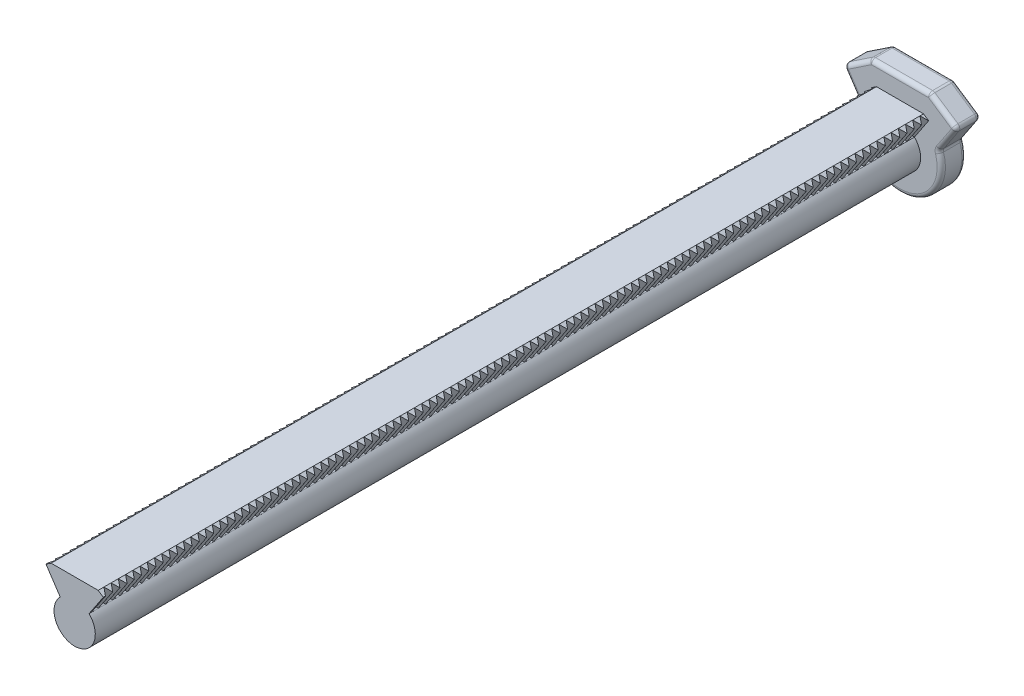
from build123d import *
from OCP.BRepFilletAPI import BRepFilletAPI_MakeChamfer

# Parameters (mm, degrees)
SALIENTE_EXTRUIR1_DEPTH  = 200
CHAFL_N2_SIZE            = 1
CHAFL_N2_SIZE2           = 1.800819464
CORTAR_EXTRUIR1_DEPTH    = 6.2
MATRIZL1_COUNT           = 114
MATRIZL1_PITCH           = 1.75
SIMETR_A1_COPY_1_DEPTH   = 6.2
SIMETR_A1_COPY_2_DEPTH   = 6.2
SIMETR_A1_COPY_3_DEPTH   = 6.2
SIMETR_A1_COPY_4_DEPTH   = 6.2
SIMETR_A1_COPY_5_DEPTH   = 6.2
SIMETR_A1_COPY_6_DEPTH   = 6.2
SIMETR_A1_COPY_7_DEPTH   = 6.2
SIMETR_A1_COPY_8_DEPTH   = 6.2
SIMETR_A1_COPY_9_DEPTH   = 6.2
SIMETR_A1_COPY_10_DEPTH  = 6.2
SIMETR_A1_COPY_11_DEPTH  = 6.2
SIMETR_A1_COPY_12_DEPTH  = 6.2
SIMETR_A1_COPY_13_DEPTH  = 6.2
SIMETR_A1_COPY_14_DEPTH  = 6.2
SIMETR_A1_COPY_15_DEPTH  = 6.2
SIMETR_A1_COPY_16_DEPTH  = 6.2
SIMETR_A1_COPY_17_DEPTH  = 6.2
SIMETR_A1_COPY_18_DEPTH  = 6.2
SIMETR_A1_COPY_19_DEPTH  = 6.2
SIMETR_A1_COPY_20_DEPTH  = 6.2
SIMETR_A1_COPY_21_DEPTH  = 6.2
SIMETR_A1_COPY_22_DEPTH  = 6.2
SIMETR_A1_COPY_23_DEPTH  = 6.2
SIMETR_A1_COPY_24_DEPTH  = 6.2
SIMETR_A1_COPY_25_DEPTH  = 6.2
SIMETR_A1_COPY_26_DEPTH  = 6.2
SIMETR_A1_COPY_27_DEPTH  = 6.2
SIMETR_A1_COPY_28_DEPTH  = 6.2
SIMETR_A1_COPY_29_DEPTH  = 6.2
SIMETR_A1_COPY_30_DEPTH  = 6.2
SIMETR_A1_COPY_31_DEPTH  = 6.2
SIMETR_A1_COPY_32_DEPTH  = 6.2
SIMETR_A1_COPY_33_DEPTH  = 6.2
SIMETR_A1_COPY_34_DEPTH  = 6.2
SIMETR_A1_COPY_35_DEPTH  = 6.2
SIMETR_A1_COPY_36_DEPTH  = 6.2
SIMETR_A1_COPY_37_DEPTH  = 6.2
SIMETR_A1_COPY_38_DEPTH  = 6.2
SIMETR_A1_COPY_39_DEPTH  = 6.2
SIMETR_A1_COPY_40_DEPTH  = 6.2
SIMETR_A1_COPY_41_DEPTH  = 6.2
SIMETR_A1_COPY_42_DEPTH  = 6.2
SIMETR_A1_COPY_43_DEPTH  = 6.2
SIMETR_A1_COPY_44_DEPTH  = 6.2
SIMETR_A1_COPY_45_DEPTH  = 6.2
SIMETR_A1_COPY_46_DEPTH  = 6.2
SIMETR_A1_COPY_47_DEPTH  = 6.2
SIMETR_A1_COPY_48_DEPTH  = 6.2
SIMETR_A1_COPY_49_DEPTH  = 6.2
SIMETR_A1_COPY_50_DEPTH  = 6.2
SIMETR_A1_COPY_51_DEPTH  = 6.2
SIMETR_A1_COPY_52_DEPTH  = 6.2
SIMETR_A1_COPY_53_DEPTH  = 6.2
SIMETR_A1_COPY_54_DEPTH  = 6.2
SIMETR_A1_COPY_55_DEPTH  = 6.2
SIMETR_A1_COPY_56_DEPTH  = 6.2
SIMETR_A1_COPY_57_DEPTH  = 6.2
SIMETR_A1_COPY_58_DEPTH  = 6.2
SIMETR_A1_COPY_59_DEPTH  = 6.2
SIMETR_A1_COPY_60_DEPTH  = 6.2
SIMETR_A1_COPY_61_DEPTH  = 6.2
SIMETR_A1_COPY_62_DEPTH  = 6.2
SIMETR_A1_COPY_63_DEPTH  = 6.2
SIMETR_A1_COPY_64_DEPTH  = 6.2
SIMETR_A1_COPY_65_DEPTH  = 6.2
SIMETR_A1_COPY_66_DEPTH  = 6.2
SIMETR_A1_COPY_67_DEPTH  = 6.2
SIMETR_A1_COPY_68_DEPTH  = 6.2
SIMETR_A1_COPY_69_DEPTH  = 6.2
SIMETR_A1_COPY_70_DEPTH  = 6.2
SIMETR_A1_COPY_71_DEPTH  = 6.2
SIMETR_A1_COPY_72_DEPTH  = 6.2
SIMETR_A1_COPY_73_DEPTH  = 6.2
SIMETR_A1_COPY_74_DEPTH  = 6.2
SIMETR_A1_COPY_75_DEPTH  = 6.2
SIMETR_A1_COPY_76_DEPTH  = 6.2
SIMETR_A1_COPY_77_DEPTH  = 6.2
SIMETR_A1_COPY_78_DEPTH  = 6.2
SIMETR_A1_COPY_79_DEPTH  = 6.2
SIMETR_A1_COPY_80_DEPTH  = 6.2
SIMETR_A1_COPY_81_DEPTH  = 6.2
SIMETR_A1_COPY_82_DEPTH  = 6.2
SIMETR_A1_COPY_83_DEPTH  = 6.2
SIMETR_A1_COPY_84_DEPTH  = 6.2
SIMETR_A1_COPY_85_DEPTH  = 6.2
SIMETR_A1_COPY_86_DEPTH  = 6.2
SIMETR_A1_COPY_87_DEPTH  = 6.2
SIMETR_A1_COPY_88_DEPTH  = 6.2
SIMETR_A1_COPY_89_DEPTH  = 6.2
SIMETR_A1_COPY_90_DEPTH  = 6.2
SIMETR_A1_COPY_91_DEPTH  = 6.2
SIMETR_A1_COPY_92_DEPTH  = 6.2
SIMETR_A1_COPY_93_DEPTH  = 6.2
SIMETR_A1_COPY_94_DEPTH  = 6.2
SIMETR_A1_COPY_95_DEPTH  = 6.2
SIMETR_A1_COPY_96_DEPTH  = 6.2
SIMETR_A1_COPY_97_DEPTH  = 6.2
SIMETR_A1_COPY_98_DEPTH  = 6.2
SIMETR_A1_COPY_99_DEPTH  = 6.2
SIMETR_A1_COPY_100_DEPTH = 6.2
SIMETR_A1_COPY_101_DEPTH = 6.2
SIMETR_A1_COPY_102_DEPTH = 6.2
SIMETR_A1_COPY_103_DEPTH = 6.2
SIMETR_A1_COPY_104_DEPTH = 6.2
SIMETR_A1_COPY_105_DEPTH = 6.2
SIMETR_A1_COPY_106_DEPTH = 6.2
SIMETR_A1_COPY_107_DEPTH = 6.2
SIMETR_A1_COPY_108_DEPTH = 6.2
SIMETR_A1_COPY_109_DEPTH = 6.2
SIMETR_A1_COPY_110_DEPTH = 6.2
SIMETR_A1_COPY_111_DEPTH = 6.2
SIMETR_A1_COPY_112_DEPTH = 6.2
SIMETR_A1_COPY_113_DEPTH = 6.2
SALIENTE_EXTRUIR2_DEPTH  = 6
REDONDEO1_R              = 1


with BuildPart() as part:
    # Croquis1 → Saliente-Extruir1 (new body)
    with BuildSketch(Plane.XY):
        with BuildLine():
            ThreePointArc((3.493719232, 3.576859786), (0, 5), (-3.493719232, 3.576859786))
            Line((-3.493719232, 3.576859786), (3.493719232, 3.576859786))
        make_face()
        with BuildLine():
            Line((3.493719232, 3.576859786), (-3.493719232, 3.576859786))
            ThreePointArc((-3.493719232, 3.576859786), (-1.940541656, -4.608068802), (5, 0))
            ThreePointArc((5, 0), (4.608068802, 1.940541656), (3.493719232, 3.576859786))
        make_face()
        with BuildLine():
            Line((-7.5, 9.576859786), (-3.493719232, 3.576859786))
            ThreePointArc((-3.493719232, 3.576859786), (0, 5), (3.493719232, 3.576859786))
            Line((3.493719232, 3.576859786), (7.5, 9.576859786))
            Line((7.5, 9.576859786), (-7.5, 9.576859786))
        make_face()
    extrude(amount=SALIENTE_EXTRUIR1_DEPTH)

    # Chaflán2: one chamfer whose edges measure the first distance from different faces: ONE call of the kernel's chamfer builder (chamfer() names one face for all edges)
    chafl_n2_edges_1 = [part.edges().sort_by_distance(p)[0] for p in [
        (-7.5, 9.576859786, 100),
    ]]
    chafl_n2_side_1 = [part.faces().sort_by_distance(p)[0] for p in [
        (-5.496859616, 6.576859786, 100),
    ]]
    chafl_n2_edges_2 = [part.edges().sort_by_distance(p)[0] for p in [
        (7.5, 9.576859786, 100),
    ]]
    chafl_n2_side_2 = [part.faces().sort_by_distance(p)[0] for p in [
        (5.496859616, 6.576859786, 100),
    ]]
    chafl_n2 = BRepFilletAPI_MakeChamfer(part.part.solid().wrapped)
    for e in chafl_n2_edges_1:
        chafl_n2.Add(CHAFL_N2_SIZE, CHAFL_N2_SIZE2, e.wrapped, chafl_n2_side_1[0].wrapped)  # the first distance lies on this face
    for e in chafl_n2_edges_2:
        chafl_n2.Add(CHAFL_N2_SIZE, CHAFL_N2_SIZE2, e.wrapped, chafl_n2_side_2[0].wrapped)  # the first distance lies on this face
    add(Compound.cast(chafl_n2.Shape()), mode=Mode.REPLACE)

    # Croquis2 → Cortar-Extruir1 (cut)
    with BuildSketch(Plane(origin=(6.180158411, 9.255704384, 0), x_dir=(0.8316482768383068, -0.555302749526666, 0), z_dir=(0.555302749526666, 0.8316482768383068, 0))):
        Polygon((0.919305505, 0), (0.919305505, -1.729335419), (-0.578342899, -0.864667709), align=None)
    cortar_extruir1 = extrude(amount=-CORTAR_EXTRUIR1_DEPTH, mode=Mode.SUBTRACT)

    # MatrizL1: Cortar-Extruir1 ×114
    with Locations(*[(0, 0, i * MATRIZL1_PITCH) for i in range(1, MATRIZL1_COUNT)]):
        add(cortar_extruir1, mode=Mode.SUBTRACT)

    # Simetría1: Cortar-Extruir1 across plane
    add(cortar_extruir1.mirror(Plane(origin=(0, 0, 0), x_dir=(0, 0, 1), z_dir=(1, 0, 0))), mode=Mode.SUBTRACT)

    # Simetría1 copy 1 sketch → Simetría1 copy 1 (cut)
    with BuildSketch(Plane(origin=(-6.180158411, 9.255704384, 1.75), x_dir=(-0.8316482768383068, -0.555302749526666, 0), z_dir=(-0.555302749526666, 0.8316482768383068, 0))):
        Polygon((0.919305505, 0), (0.919305505, 1.729335419), (-0.578342899, 0.864667709), align=None)
    extrude(amount=-SIMETR_A1_COPY_1_DEPTH, mode=Mode.SUBTRACT)

    # Simetría1 copy 2 sketch → Simetría1 copy 2 (cut)
    with BuildSketch(Plane(origin=(-6.180158411, 9.255704384, 3.5), x_dir=(-0.8316482768383068, -0.555302749526666, 0), z_dir=(-0.555302749526666, 0.8316482768383068, 0))):
        Polygon((0.919305505, 0), (0.919305505, 1.729335419), (-0.578342899, 0.864667709), align=None)
    extrude(amount=-SIMETR_A1_COPY_2_DEPTH, mode=Mode.SUBTRACT)

    # Simetría1 copy 3 sketch → Simetría1 copy 3 (cut)
    with BuildSketch(Plane(origin=(-6.180158411, 9.255704384, 5.25), x_dir=(-0.8316482768383068, -0.555302749526666, 0), z_dir=(-0.555302749526666, 0.8316482768383068, 0))):
        Polygon((0.919305505, 0), (0.919305505, 1.729335419), (-0.578342899, 0.864667709), align=None)
    extrude(amount=-SIMETR_A1_COPY_3_DEPTH, mode=Mode.SUBTRACT)

    # Simetría1 copy 4 sketch → Simetría1 copy 4 (cut)
    with BuildSketch(Plane(origin=(-6.180158411, 9.255704384, 7), x_dir=(-0.8316482768383068, -0.555302749526666, 0), z_dir=(-0.555302749526666, 0.8316482768383068, 0))):
        Polygon((0.919305505, 0), (0.919305505, 1.729335419), (-0.578342899, 0.864667709), align=None)
    extrude(amount=-SIMETR_A1_COPY_4_DEPTH, mode=Mode.SUBTRACT)

    # Simetría1 copy 5 sketch → Simetría1 copy 5 (cut)
    with BuildSketch(Plane(origin=(-6.180158411, 9.255704384, 8.75), x_dir=(-0.8316482768383068, -0.555302749526666, 0), z_dir=(-0.555302749526666, 0.8316482768383068, 0))):
        Polygon((0.919305505, 0), (0.919305505, 1.729335419), (-0.578342899, 0.864667709), align=None)
    extrude(amount=-SIMETR_A1_COPY_5_DEPTH, mode=Mode.SUBTRACT)

    # Simetría1 copy 6 sketch → Simetría1 copy 6 (cut)
    with BuildSketch(Plane(origin=(-6.180158411, 9.255704384, 10.5), x_dir=(-0.8316482768383068, -0.555302749526666, 0), z_dir=(-0.555302749526666, 0.8316482768383068, 0))):
        Polygon((0.919305505, 0), (0.919305505, 1.729335419), (-0.578342899, 0.864667709), align=None)
    extrude(amount=-SIMETR_A1_COPY_6_DEPTH, mode=Mode.SUBTRACT)

    # Simetría1 copy 7 sketch → Simetría1 copy 7 (cut)
    with BuildSketch(Plane(origin=(-6.180158411, 9.255704384, 12.25), x_dir=(-0.8316482768383068, -0.555302749526666, 0), z_dir=(-0.555302749526666, 0.8316482768383068, 0))):
        Polygon((0.919305505, 0), (0.919305505, 1.729335419), (-0.578342899, 0.864667709), align=None)
    extrude(amount=-SIMETR_A1_COPY_7_DEPTH, mode=Mode.SUBTRACT)

    # Simetría1 copy 8 sketch → Simetría1 copy 8 (cut)
    with BuildSketch(Plane(origin=(-6.180158411, 9.255704384, 14), x_dir=(-0.8316482768383068, -0.555302749526666, 0), z_dir=(-0.555302749526666, 0.8316482768383068, 0))):
        Polygon((0.919305505, 0), (0.919305505, 1.729335419), (-0.578342899, 0.864667709), align=None)
    extrude(amount=-SIMETR_A1_COPY_8_DEPTH, mode=Mode.SUBTRACT)

    # Simetría1 copy 9 sketch → Simetría1 copy 9 (cut)
    with BuildSketch(Plane(origin=(-6.180158411, 9.255704384, 15.75), x_dir=(-0.8316482768383068, -0.555302749526666, 0), z_dir=(-0.555302749526666, 0.8316482768383068, 0))):
        Polygon((0.919305505, 0), (0.919305505, 1.729335419), (-0.578342899, 0.864667709), align=None)
    extrude(amount=-SIMETR_A1_COPY_9_DEPTH, mode=Mode.SUBTRACT)

    # Simetría1 copy 10 sketch → Simetría1 copy 10 (cut)
    with BuildSketch(Plane(origin=(-6.180158411, 9.255704384, 17.5), x_dir=(-0.8316482768383068, -0.555302749526666, 0), z_dir=(-0.555302749526666, 0.8316482768383068, 0))):
        Polygon((0.919305505, 0), (0.919305505, 1.729335419), (-0.578342899, 0.864667709), align=None)
    extrude(amount=-SIMETR_A1_COPY_10_DEPTH, mode=Mode.SUBTRACT)

    # Simetría1 copy 11 sketch → Simetría1 copy 11 (cut)
    with BuildSketch(Plane(origin=(-6.180158411, 9.255704384, 19.25), x_dir=(-0.8316482768383068, -0.555302749526666, 0), z_dir=(-0.555302749526666, 0.8316482768383068, 0))):
        Polygon((0.919305505, 0), (0.919305505, 1.729335419), (-0.578342899, 0.864667709), align=None)
    extrude(amount=-SIMETR_A1_COPY_11_DEPTH, mode=Mode.SUBTRACT)

    # Simetría1 copy 12 sketch → Simetría1 copy 12 (cut)
    with BuildSketch(Plane(origin=(-6.180158411, 9.255704384, 21), x_dir=(-0.8316482768383068, -0.555302749526666, 0), z_dir=(-0.555302749526666, 0.8316482768383068, 0))):
        Polygon((0.919305505, 0), (0.919305505, 1.729335419), (-0.578342899, 0.864667709), align=None)
    extrude(amount=-SIMETR_A1_COPY_12_DEPTH, mode=Mode.SUBTRACT)

    # Simetría1 copy 13 sketch → Simetría1 copy 13 (cut)
    with BuildSketch(Plane(origin=(-6.180158411, 9.255704384, 22.75), x_dir=(-0.8316482768383068, -0.555302749526666, 0), z_dir=(-0.555302749526666, 0.8316482768383068, 0))):
        Polygon((0.919305505, 0), (0.919305505, 1.729335419), (-0.578342899, 0.864667709), align=None)
    extrude(amount=-SIMETR_A1_COPY_13_DEPTH, mode=Mode.SUBTRACT)

    # Simetría1 copy 14 sketch → Simetría1 copy 14 (cut)
    with BuildSketch(Plane(origin=(-6.180158411, 9.255704384, 24.5), x_dir=(-0.8316482768383068, -0.555302749526666, 0), z_dir=(-0.555302749526666, 0.8316482768383068, 0))):
        Polygon((0.919305505, 0), (0.919305505, 1.729335419), (-0.578342899, 0.864667709), align=None)
    extrude(amount=-SIMETR_A1_COPY_14_DEPTH, mode=Mode.SUBTRACT)

    # Simetría1 copy 15 sketch → Simetría1 copy 15 (cut)
    with BuildSketch(Plane(origin=(-6.180158411, 9.255704384, 26.25), x_dir=(-0.8316482768383068, -0.555302749526666, 0), z_dir=(-0.555302749526666, 0.8316482768383068, 0))):
        Polygon((0.919305505, 0), (0.919305505, 1.729335419), (-0.578342899, 0.864667709), align=None)
    extrude(amount=-SIMETR_A1_COPY_15_DEPTH, mode=Mode.SUBTRACT)

    # Simetría1 copy 16 sketch → Simetría1 copy 16 (cut)
    with BuildSketch(Plane(origin=(-6.180158411, 9.255704384, 28), x_dir=(-0.8316482768383068, -0.555302749526666, 0), z_dir=(-0.555302749526666, 0.8316482768383068, 0))):
        Polygon((0.919305505, 0), (0.919305505, 1.729335419), (-0.578342899, 0.864667709), align=None)
    extrude(amount=-SIMETR_A1_COPY_16_DEPTH, mode=Mode.SUBTRACT)

    # Simetría1 copy 17 sketch → Simetría1 copy 17 (cut)
    with BuildSketch(Plane(origin=(-6.180158411, 9.255704384, 29.75), x_dir=(-0.8316482768383068, -0.555302749526666, 0), z_dir=(-0.555302749526666, 0.8316482768383068, 0))):
        Polygon((0.919305505, 0), (0.919305505, 1.729335419), (-0.578342899, 0.864667709), align=None)
    extrude(amount=-SIMETR_A1_COPY_17_DEPTH, mode=Mode.SUBTRACT)

    # Simetría1 copy 18 sketch → Simetría1 copy 18 (cut)
    with BuildSketch(Plane(origin=(-6.180158411, 9.255704384, 31.5), x_dir=(-0.8316482768383068, -0.555302749526666, 0), z_dir=(-0.555302749526666, 0.8316482768383068, 0))):
        Polygon((0.919305505, 0), (0.919305505, 1.729335419), (-0.578342899, 0.864667709), align=None)
    extrude(amount=-SIMETR_A1_COPY_18_DEPTH, mode=Mode.SUBTRACT)

    # Simetría1 copy 19 sketch → Simetría1 copy 19 (cut)
    with BuildSketch(Plane(origin=(-6.180158411, 9.255704384, 33.25), x_dir=(-0.8316482768383068, -0.555302749526666, 0), z_dir=(-0.555302749526666, 0.8316482768383068, 0))):
        Polygon((0.919305505, 0), (0.919305505, 1.729335419), (-0.578342899, 0.864667709), align=None)
    extrude(amount=-SIMETR_A1_COPY_19_DEPTH, mode=Mode.SUBTRACT)

    # Simetría1 copy 20 sketch → Simetría1 copy 20 (cut)
    with BuildSketch(Plane(origin=(-6.180158411, 9.255704384, 35), x_dir=(-0.8316482768383068, -0.555302749526666, 0), z_dir=(-0.555302749526666, 0.8316482768383068, 0))):
        Polygon((0.919305505, 0), (0.919305505, 1.729335419), (-0.578342899, 0.864667709), align=None)
    extrude(amount=-SIMETR_A1_COPY_20_DEPTH, mode=Mode.SUBTRACT)

    # Simetría1 copy 21 sketch → Simetría1 copy 21 (cut)
    with BuildSketch(Plane(origin=(-6.180158411, 9.255704384, 36.75), x_dir=(-0.8316482768383068, -0.555302749526666, 0), z_dir=(-0.555302749526666, 0.8316482768383068, 0))):
        Polygon((0.919305505, 0), (0.919305505, 1.729335419), (-0.578342899, 0.864667709), align=None)
    extrude(amount=-SIMETR_A1_COPY_21_DEPTH, mode=Mode.SUBTRACT)

    # Simetría1 copy 22 sketch → Simetría1 copy 22 (cut)
    with BuildSketch(Plane(origin=(-6.180158411, 9.255704384, 38.5), x_dir=(-0.8316482768383068, -0.555302749526666, 0), z_dir=(-0.555302749526666, 0.8316482768383068, 0))):
        Polygon((0.919305505, 0), (0.919305505, 1.729335419), (-0.578342899, 0.864667709), align=None)
    extrude(amount=-SIMETR_A1_COPY_22_DEPTH, mode=Mode.SUBTRACT)

    # Simetría1 copy 23 sketch → Simetría1 copy 23 (cut)
    with BuildSketch(Plane(origin=(-6.180158411, 9.255704384, 40.25), x_dir=(-0.8316482768383068, -0.555302749526666, 0), z_dir=(-0.555302749526666, 0.8316482768383068, 0))):
        Polygon((0.919305505, 0), (0.919305505, 1.729335419), (-0.578342899, 0.864667709), align=None)
    extrude(amount=-SIMETR_A1_COPY_23_DEPTH, mode=Mode.SUBTRACT)

    # Simetría1 copy 24 sketch → Simetría1 copy 24 (cut)
    with BuildSketch(Plane(origin=(-6.180158411, 9.255704384, 42), x_dir=(-0.8316482768383068, -0.555302749526666, 0), z_dir=(-0.555302749526666, 0.8316482768383068, 0))):
        Polygon((0.919305505, 0), (0.919305505, 1.729335419), (-0.578342899, 0.864667709), align=None)
    extrude(amount=-SIMETR_A1_COPY_24_DEPTH, mode=Mode.SUBTRACT)

    # Simetría1 copy 25 sketch → Simetría1 copy 25 (cut)
    with BuildSketch(Plane(origin=(-6.180158411, 9.255704384, 43.75), x_dir=(-0.8316482768383068, -0.555302749526666, 0), z_dir=(-0.555302749526666, 0.8316482768383068, 0))):
        Polygon((0.919305505, 0), (0.919305505, 1.729335419), (-0.578342899, 0.864667709), align=None)
    extrude(amount=-SIMETR_A1_COPY_25_DEPTH, mode=Mode.SUBTRACT)

    # Simetría1 copy 26 sketch → Simetría1 copy 26 (cut)
    with BuildSketch(Plane(origin=(-6.180158411, 9.255704384, 45.5), x_dir=(-0.8316482768383068, -0.555302749526666, 0), z_dir=(-0.555302749526666, 0.8316482768383068, 0))):
        Polygon((0.919305505, 0), (0.919305505, 1.729335419), (-0.578342899, 0.864667709), align=None)
    extrude(amount=-SIMETR_A1_COPY_26_DEPTH, mode=Mode.SUBTRACT)

    # Simetría1 copy 27 sketch → Simetría1 copy 27 (cut)
    with BuildSketch(Plane(origin=(-6.180158411, 9.255704384, 47.25), x_dir=(-0.8316482768383068, -0.555302749526666, 0), z_dir=(-0.555302749526666, 0.8316482768383068, 0))):
        Polygon((0.919305505, 0), (0.919305505, 1.729335419), (-0.578342899, 0.864667709), align=None)
    extrude(amount=-SIMETR_A1_COPY_27_DEPTH, mode=Mode.SUBTRACT)

    # Simetría1 copy 28 sketch → Simetría1 copy 28 (cut)
    with BuildSketch(Plane(origin=(-6.180158411, 9.255704384, 49), x_dir=(-0.8316482768383068, -0.555302749526666, 0), z_dir=(-0.555302749526666, 0.8316482768383068, 0))):
        Polygon((0.919305505, 0), (0.919305505, 1.729335419), (-0.578342899, 0.864667709), align=None)
    extrude(amount=-SIMETR_A1_COPY_28_DEPTH, mode=Mode.SUBTRACT)

    # Simetría1 copy 29 sketch → Simetría1 copy 29 (cut)
    with BuildSketch(Plane(origin=(-6.180158411, 9.255704384, 50.75), x_dir=(-0.8316482768383068, -0.555302749526666, 0), z_dir=(-0.555302749526666, 0.8316482768383068, 0))):
        Polygon((0.919305505, 0), (0.919305505, 1.729335419), (-0.578342899, 0.864667709), align=None)
    extrude(amount=-SIMETR_A1_COPY_29_DEPTH, mode=Mode.SUBTRACT)

    # Simetría1 copy 30 sketch → Simetría1 copy 30 (cut)
    with BuildSketch(Plane(origin=(-6.180158411, 9.255704384, 52.5), x_dir=(-0.8316482768383068, -0.555302749526666, 0), z_dir=(-0.555302749526666, 0.8316482768383068, 0))):
        Polygon((0.919305505, 0), (0.919305505, 1.729335419), (-0.578342899, 0.864667709), align=None)
    extrude(amount=-SIMETR_A1_COPY_30_DEPTH, mode=Mode.SUBTRACT)

    # Simetría1 copy 31 sketch → Simetría1 copy 31 (cut)
    with BuildSketch(Plane(origin=(-6.180158411, 9.255704384, 54.25), x_dir=(-0.8316482768383068, -0.555302749526666, 0), z_dir=(-0.555302749526666, 0.8316482768383068, 0))):
        Polygon((0.919305505, 0), (0.919305505, 1.729335419), (-0.578342899, 0.864667709), align=None)
    extrude(amount=-SIMETR_A1_COPY_31_DEPTH, mode=Mode.SUBTRACT)

    # Simetría1 copy 32 sketch → Simetría1 copy 32 (cut)
    with BuildSketch(Plane(origin=(-6.180158411, 9.255704384, 56), x_dir=(-0.8316482768383068, -0.555302749526666, 0), z_dir=(-0.555302749526666, 0.8316482768383068, 0))):
        Polygon((0.919305505, 0), (0.919305505, 1.729335419), (-0.578342899, 0.864667709), align=None)
    extrude(amount=-SIMETR_A1_COPY_32_DEPTH, mode=Mode.SUBTRACT)

    # Simetría1 copy 33 sketch → Simetría1 copy 33 (cut)
    with BuildSketch(Plane(origin=(-6.180158411, 9.255704384, 57.75), x_dir=(-0.8316482768383068, -0.555302749526666, 0), z_dir=(-0.555302749526666, 0.8316482768383068, 0))):
        Polygon((0.919305505, 0), (0.919305505, 1.729335419), (-0.578342899, 0.864667709), align=None)
    extrude(amount=-SIMETR_A1_COPY_33_DEPTH, mode=Mode.SUBTRACT)

    # Simetría1 copy 34 sketch → Simetría1 copy 34 (cut)
    with BuildSketch(Plane(origin=(-6.180158411, 9.255704384, 59.5), x_dir=(-0.8316482768383068, -0.555302749526666, 0), z_dir=(-0.555302749526666, 0.8316482768383068, 0))):
        Polygon((0.919305505, 0), (0.919305505, 1.729335419), (-0.578342899, 0.864667709), align=None)
    extrude(amount=-SIMETR_A1_COPY_34_DEPTH, mode=Mode.SUBTRACT)

    # Simetría1 copy 35 sketch → Simetría1 copy 35 (cut)
    with BuildSketch(Plane(origin=(-6.180158411, 9.255704384, 61.25), x_dir=(-0.8316482768383068, -0.555302749526666, 0), z_dir=(-0.555302749526666, 0.8316482768383068, 0))):
        Polygon((0.919305505, 0), (0.919305505, 1.729335419), (-0.578342899, 0.864667709), align=None)
    extrude(amount=-SIMETR_A1_COPY_35_DEPTH, mode=Mode.SUBTRACT)

    # Simetría1 copy 36 sketch → Simetría1 copy 36 (cut)
    with BuildSketch(Plane(origin=(-6.180158411, 9.255704384, 63), x_dir=(-0.8316482768383068, -0.555302749526666, 0), z_dir=(-0.555302749526666, 0.8316482768383068, 0))):
        Polygon((0.919305505, 0), (0.919305505, 1.729335419), (-0.578342899, 0.864667709), align=None)
    extrude(amount=-SIMETR_A1_COPY_36_DEPTH, mode=Mode.SUBTRACT)

    # Simetría1 copy 37 sketch → Simetría1 copy 37 (cut)
    with BuildSketch(Plane(origin=(-6.180158411, 9.255704384, 64.75), x_dir=(-0.8316482768383068, -0.555302749526666, 0), z_dir=(-0.555302749526666, 0.8316482768383068, 0))):
        Polygon((0.919305505, 0), (0.919305505, 1.729335419), (-0.578342899, 0.864667709), align=None)
    extrude(amount=-SIMETR_A1_COPY_37_DEPTH, mode=Mode.SUBTRACT)

    # Simetría1 copy 38 sketch → Simetría1 copy 38 (cut)
    with BuildSketch(Plane(origin=(-6.180158411, 9.255704384, 66.5), x_dir=(-0.8316482768383068, -0.555302749526666, 0), z_dir=(-0.555302749526666, 0.8316482768383068, 0))):
        Polygon((0.919305505, 0), (0.919305505, 1.729335419), (-0.578342899, 0.864667709), align=None)
    extrude(amount=-SIMETR_A1_COPY_38_DEPTH, mode=Mode.SUBTRACT)

    # Simetría1 copy 39 sketch → Simetría1 copy 39 (cut)
    with BuildSketch(Plane(origin=(-6.180158411, 9.255704384, 68.25), x_dir=(-0.8316482768383068, -0.555302749526666, 0), z_dir=(-0.555302749526666, 0.8316482768383068, 0))):
        Polygon((0.919305505, 0), (0.919305505, 1.729335419), (-0.578342899, 0.864667709), align=None)
    extrude(amount=-SIMETR_A1_COPY_39_DEPTH, mode=Mode.SUBTRACT)

    # Simetría1 copy 40 sketch → Simetría1 copy 40 (cut)
    with BuildSketch(Plane(origin=(-6.180158411, 9.255704384, 70), x_dir=(-0.8316482768383068, -0.555302749526666, 0), z_dir=(-0.555302749526666, 0.8316482768383068, 0))):
        Polygon((0.919305505, 0), (0.919305505, 1.729335419), (-0.578342899, 0.864667709), align=None)
    extrude(amount=-SIMETR_A1_COPY_40_DEPTH, mode=Mode.SUBTRACT)

    # Simetría1 copy 41 sketch → Simetría1 copy 41 (cut)
    with BuildSketch(Plane(origin=(-6.180158411, 9.255704384, 71.75), x_dir=(-0.8316482768383068, -0.555302749526666, 0), z_dir=(-0.555302749526666, 0.8316482768383068, 0))):
        Polygon((0.919305505, 0), (0.919305505, 1.729335419), (-0.578342899, 0.864667709), align=None)
    extrude(amount=-SIMETR_A1_COPY_41_DEPTH, mode=Mode.SUBTRACT)

    # Simetría1 copy 42 sketch → Simetría1 copy 42 (cut)
    with BuildSketch(Plane(origin=(-6.180158411, 9.255704384, 73.5), x_dir=(-0.8316482768383068, -0.555302749526666, 0), z_dir=(-0.555302749526666, 0.8316482768383068, 0))):
        Polygon((0.919305505, 0), (0.919305505, 1.729335419), (-0.578342899, 0.864667709), align=None)
    extrude(amount=-SIMETR_A1_COPY_42_DEPTH, mode=Mode.SUBTRACT)

    # Simetría1 copy 43 sketch → Simetría1 copy 43 (cut)
    with BuildSketch(Plane(origin=(-6.180158411, 9.255704384, 75.25), x_dir=(-0.8316482768383068, -0.555302749526666, 0), z_dir=(-0.555302749526666, 0.8316482768383068, 0))):
        Polygon((0.919305505, 0), (0.919305505, 1.729335419), (-0.578342899, 0.864667709), align=None)
    extrude(amount=-SIMETR_A1_COPY_43_DEPTH, mode=Mode.SUBTRACT)

    # Simetría1 copy 44 sketch → Simetría1 copy 44 (cut)
    with BuildSketch(Plane(origin=(-6.180158411, 9.255704384, 77), x_dir=(-0.8316482768383068, -0.555302749526666, 0), z_dir=(-0.555302749526666, 0.8316482768383068, 0))):
        Polygon((0.919305505, 0), (0.919305505, 1.729335419), (-0.578342899, 0.864667709), align=None)
    extrude(amount=-SIMETR_A1_COPY_44_DEPTH, mode=Mode.SUBTRACT)

    # Simetría1 copy 45 sketch → Simetría1 copy 45 (cut)
    with BuildSketch(Plane(origin=(-6.180158411, 9.255704384, 78.75), x_dir=(-0.8316482768383068, -0.555302749526666, 0), z_dir=(-0.555302749526666, 0.8316482768383068, 0))):
        Polygon((0.919305505, 0), (0.919305505, 1.729335419), (-0.578342899, 0.864667709), align=None)
    extrude(amount=-SIMETR_A1_COPY_45_DEPTH, mode=Mode.SUBTRACT)

    # Simetría1 copy 46 sketch → Simetría1 copy 46 (cut)
    with BuildSketch(Plane(origin=(-6.180158411, 9.255704384, 80.5), x_dir=(-0.8316482768383068, -0.555302749526666, 0), z_dir=(-0.555302749526666, 0.8316482768383068, 0))):
        Polygon((0.919305505, 0), (0.919305505, 1.729335419), (-0.578342899, 0.864667709), align=None)
    extrude(amount=-SIMETR_A1_COPY_46_DEPTH, mode=Mode.SUBTRACT)

    # Simetría1 copy 47 sketch → Simetría1 copy 47 (cut)
    with BuildSketch(Plane(origin=(-6.180158411, 9.255704384, 82.25), x_dir=(-0.8316482768383068, -0.555302749526666, 0), z_dir=(-0.555302749526666, 0.8316482768383068, 0))):
        Polygon((0.919305505, 0), (0.919305505, 1.729335419), (-0.578342899, 0.864667709), align=None)
    extrude(amount=-SIMETR_A1_COPY_47_DEPTH, mode=Mode.SUBTRACT)

    # Simetría1 copy 48 sketch → Simetría1 copy 48 (cut)
    with BuildSketch(Plane(origin=(-6.180158411, 9.255704384, 84), x_dir=(-0.8316482768383068, -0.555302749526666, 0), z_dir=(-0.555302749526666, 0.8316482768383068, 0))):
        Polygon((0.919305505, 0), (0.919305505, 1.729335419), (-0.578342899, 0.864667709), align=None)
    extrude(amount=-SIMETR_A1_COPY_48_DEPTH, mode=Mode.SUBTRACT)

    # Simetría1 copy 49 sketch → Simetría1 copy 49 (cut)
    with BuildSketch(Plane(origin=(-6.180158411, 9.255704384, 85.75), x_dir=(-0.8316482768383068, -0.555302749526666, 0), z_dir=(-0.555302749526666, 0.8316482768383068, 0))):
        Polygon((0.919305505, 0), (0.919305505, 1.729335419), (-0.578342899, 0.864667709), align=None)
    extrude(amount=-SIMETR_A1_COPY_49_DEPTH, mode=Mode.SUBTRACT)

    # Simetría1 copy 50 sketch → Simetría1 copy 50 (cut)
    with BuildSketch(Plane(origin=(-6.180158411, 9.255704384, 87.5), x_dir=(-0.8316482768383068, -0.555302749526666, 0), z_dir=(-0.555302749526666, 0.8316482768383068, 0))):
        Polygon((0.919305505, 0), (0.919305505, 1.729335419), (-0.578342899, 0.864667709), align=None)
    extrude(amount=-SIMETR_A1_COPY_50_DEPTH, mode=Mode.SUBTRACT)

    # Simetría1 copy 51 sketch → Simetría1 copy 51 (cut)
    with BuildSketch(Plane(origin=(-6.180158411, 9.255704384, 89.25), x_dir=(-0.8316482768383068, -0.555302749526666, 0), z_dir=(-0.555302749526666, 0.8316482768383068, 0))):
        Polygon((0.919305505, 0), (0.919305505, 1.729335419), (-0.578342899, 0.864667709), align=None)
    extrude(amount=-SIMETR_A1_COPY_51_DEPTH, mode=Mode.SUBTRACT)

    # Simetría1 copy 52 sketch → Simetría1 copy 52 (cut)
    with BuildSketch(Plane(origin=(-6.180158411, 9.255704384, 91), x_dir=(-0.8316482768383068, -0.555302749526666, 0), z_dir=(-0.555302749526666, 0.8316482768383068, 0))):
        Polygon((0.919305505, 0), (0.919305505, 1.729335419), (-0.578342899, 0.864667709), align=None)
    extrude(amount=-SIMETR_A1_COPY_52_DEPTH, mode=Mode.SUBTRACT)

    # Simetría1 copy 53 sketch → Simetría1 copy 53 (cut)
    with BuildSketch(Plane(origin=(-6.180158411, 9.255704384, 92.75), x_dir=(-0.8316482768383068, -0.555302749526666, 0), z_dir=(-0.555302749526666, 0.8316482768383068, 0))):
        Polygon((0.919305505, 0), (0.919305505, 1.729335419), (-0.578342899, 0.864667709), align=None)
    extrude(amount=-SIMETR_A1_COPY_53_DEPTH, mode=Mode.SUBTRACT)

    # Simetría1 copy 54 sketch → Simetría1 copy 54 (cut)
    with BuildSketch(Plane(origin=(-6.180158411, 9.255704384, 94.5), x_dir=(-0.8316482768383068, -0.555302749526666, 0), z_dir=(-0.555302749526666, 0.8316482768383068, 0))):
        Polygon((0.919305505, 0), (0.919305505, 1.729335419), (-0.578342899, 0.864667709), align=None)
    extrude(amount=-SIMETR_A1_COPY_54_DEPTH, mode=Mode.SUBTRACT)

    # Simetría1 copy 55 sketch → Simetría1 copy 55 (cut)
    with BuildSketch(Plane(origin=(-6.180158411, 9.255704384, 96.25), x_dir=(-0.8316482768383068, -0.555302749526666, 0), z_dir=(-0.555302749526666, 0.8316482768383068, 0))):
        Polygon((0.919305505, 0), (0.919305505, 1.729335419), (-0.578342899, 0.864667709), align=None)
    extrude(amount=-SIMETR_A1_COPY_55_DEPTH, mode=Mode.SUBTRACT)

    # Simetría1 copy 56 sketch → Simetría1 copy 56 (cut)
    with BuildSketch(Plane(origin=(-6.180158411, 9.255704384, 98), x_dir=(-0.8316482768383068, -0.555302749526666, 0), z_dir=(-0.555302749526666, 0.8316482768383068, 0))):
        Polygon((0.919305505, 0), (0.919305505, 1.729335419), (-0.578342899, 0.864667709), align=None)
    extrude(amount=-SIMETR_A1_COPY_56_DEPTH, mode=Mode.SUBTRACT)

    # Simetría1 copy 57 sketch → Simetría1 copy 57 (cut)
    with BuildSketch(Plane(origin=(-6.180158411, 9.255704384, 99.75), x_dir=(-0.8316482768383068, -0.555302749526666, 0), z_dir=(-0.555302749526666, 0.8316482768383068, 0))):
        Polygon((0.919305505, 0), (0.919305505, 1.729335419), (-0.578342899, 0.864667709), align=None)
    extrude(amount=-SIMETR_A1_COPY_57_DEPTH, mode=Mode.SUBTRACT)

    # Simetría1 copy 58 sketch → Simetría1 copy 58 (cut)
    with BuildSketch(Plane(origin=(-6.180158411, 9.255704384, 101.5), x_dir=(-0.8316482768383068, -0.555302749526666, 0), z_dir=(-0.555302749526666, 0.8316482768383068, 0))):
        Polygon((0.919305505, 0), (0.919305505, 1.729335419), (-0.578342899, 0.864667709), align=None)
    extrude(amount=-SIMETR_A1_COPY_58_DEPTH, mode=Mode.SUBTRACT)

    # Simetría1 copy 59 sketch → Simetría1 copy 59 (cut)
    with BuildSketch(Plane(origin=(-6.180158411, 9.255704384, 103.25), x_dir=(-0.8316482768383068, -0.555302749526666, 0), z_dir=(-0.555302749526666, 0.8316482768383068, 0))):
        Polygon((0.919305505, 0), (0.919305505, 1.729335419), (-0.578342899, 0.864667709), align=None)
    extrude(amount=-SIMETR_A1_COPY_59_DEPTH, mode=Mode.SUBTRACT)

    # Simetría1 copy 60 sketch → Simetría1 copy 60 (cut)
    with BuildSketch(Plane(origin=(-6.180158411, 9.255704384, 105), x_dir=(-0.8316482768383068, -0.555302749526666, 0), z_dir=(-0.555302749526666, 0.8316482768383068, 0))):
        Polygon((0.919305505, 0), (0.919305505, 1.729335419), (-0.578342899, 0.864667709), align=None)
    extrude(amount=-SIMETR_A1_COPY_60_DEPTH, mode=Mode.SUBTRACT)

    # Simetría1 copy 61 sketch → Simetría1 copy 61 (cut)
    with BuildSketch(Plane(origin=(-6.180158411, 9.255704384, 106.75), x_dir=(-0.8316482768383068, -0.555302749526666, 0), z_dir=(-0.555302749526666, 0.8316482768383068, 0))):
        Polygon((0.919305505, 0), (0.919305505, 1.729335419), (-0.578342899, 0.864667709), align=None)
    extrude(amount=-SIMETR_A1_COPY_61_DEPTH, mode=Mode.SUBTRACT)

    # Simetría1 copy 62 sketch → Simetría1 copy 62 (cut)
    with BuildSketch(Plane(origin=(-6.180158411, 9.255704384, 108.5), x_dir=(-0.8316482768383068, -0.555302749526666, 0), z_dir=(-0.555302749526666, 0.8316482768383068, 0))):
        Polygon((0.919305505, 0), (0.919305505, 1.729335419), (-0.578342899, 0.864667709), align=None)
    extrude(amount=-SIMETR_A1_COPY_62_DEPTH, mode=Mode.SUBTRACT)

    # Simetría1 copy 63 sketch → Simetría1 copy 63 (cut)
    with BuildSketch(Plane(origin=(-6.180158411, 9.255704384, 110.25), x_dir=(-0.8316482768383068, -0.555302749526666, 0), z_dir=(-0.555302749526666, 0.8316482768383068, 0))):
        Polygon((0.919305505, 0), (0.919305505, 1.729335419), (-0.578342899, 0.864667709), align=None)
    extrude(amount=-SIMETR_A1_COPY_63_DEPTH, mode=Mode.SUBTRACT)

    # Simetría1 copy 64 sketch → Simetría1 copy 64 (cut)
    with BuildSketch(Plane(origin=(-6.180158411, 9.255704384, 112), x_dir=(-0.8316482768383068, -0.555302749526666, 0), z_dir=(-0.555302749526666, 0.8316482768383068, 0))):
        Polygon((0.919305505, 0), (0.919305505, 1.729335419), (-0.578342899, 0.864667709), align=None)
    extrude(amount=-SIMETR_A1_COPY_64_DEPTH, mode=Mode.SUBTRACT)

    # Simetría1 copy 65 sketch → Simetría1 copy 65 (cut)
    with BuildSketch(Plane(origin=(-6.180158411, 9.255704384, 113.75), x_dir=(-0.8316482768383068, -0.555302749526666, 0), z_dir=(-0.555302749526666, 0.8316482768383068, 0))):
        Polygon((0.919305505, 0), (0.919305505, 1.729335419), (-0.578342899, 0.864667709), align=None)
    extrude(amount=-SIMETR_A1_COPY_65_DEPTH, mode=Mode.SUBTRACT)

    # Simetría1 copy 66 sketch → Simetría1 copy 66 (cut)
    with BuildSketch(Plane(origin=(-6.180158411, 9.255704384, 115.5), x_dir=(-0.8316482768383068, -0.555302749526666, 0), z_dir=(-0.555302749526666, 0.8316482768383068, 0))):
        Polygon((0.919305505, 0), (0.919305505, 1.729335419), (-0.578342899, 0.864667709), align=None)
    extrude(amount=-SIMETR_A1_COPY_66_DEPTH, mode=Mode.SUBTRACT)

    # Simetría1 copy 67 sketch → Simetría1 copy 67 (cut)
    with BuildSketch(Plane(origin=(-6.180158411, 9.255704384, 117.25), x_dir=(-0.8316482768383068, -0.555302749526666, 0), z_dir=(-0.555302749526666, 0.8316482768383068, 0))):
        Polygon((0.919305505, 0), (0.919305505, 1.729335419), (-0.578342899, 0.864667709), align=None)
    extrude(amount=-SIMETR_A1_COPY_67_DEPTH, mode=Mode.SUBTRACT)

    # Simetría1 copy 68 sketch → Simetría1 copy 68 (cut)
    with BuildSketch(Plane(origin=(-6.180158411, 9.255704384, 119), x_dir=(-0.8316482768383068, -0.555302749526666, 0), z_dir=(-0.555302749526666, 0.8316482768383068, 0))):
        Polygon((0.919305505, 0), (0.919305505, 1.729335419), (-0.578342899, 0.864667709), align=None)
    extrude(amount=-SIMETR_A1_COPY_68_DEPTH, mode=Mode.SUBTRACT)

    # Simetría1 copy 69 sketch → Simetría1 copy 69 (cut)
    with BuildSketch(Plane(origin=(-6.180158411, 9.255704384, 120.75), x_dir=(-0.8316482768383068, -0.555302749526666, 0), z_dir=(-0.555302749526666, 0.8316482768383068, 0))):
        Polygon((0.919305505, 0), (0.919305505, 1.729335419), (-0.578342899, 0.864667709), align=None)
    extrude(amount=-SIMETR_A1_COPY_69_DEPTH, mode=Mode.SUBTRACT)

    # Simetría1 copy 70 sketch → Simetría1 copy 70 (cut)
    with BuildSketch(Plane(origin=(-6.180158411, 9.255704384, 122.5), x_dir=(-0.8316482768383068, -0.555302749526666, 0), z_dir=(-0.555302749526666, 0.8316482768383068, 0))):
        Polygon((0.919305505, 0), (0.919305505, 1.729335419), (-0.578342899, 0.864667709), align=None)
    extrude(amount=-SIMETR_A1_COPY_70_DEPTH, mode=Mode.SUBTRACT)

    # Simetría1 copy 71 sketch → Simetría1 copy 71 (cut)
    with BuildSketch(Plane(origin=(-6.180158411, 9.255704384, 124.25), x_dir=(-0.8316482768383068, -0.555302749526666, 0), z_dir=(-0.555302749526666, 0.8316482768383068, 0))):
        Polygon((0.919305505, 0), (0.919305505, 1.729335419), (-0.578342899, 0.864667709), align=None)
    extrude(amount=-SIMETR_A1_COPY_71_DEPTH, mode=Mode.SUBTRACT)

    # Simetría1 copy 72 sketch → Simetría1 copy 72 (cut)
    with BuildSketch(Plane(origin=(-6.180158411, 9.255704384, 126), x_dir=(-0.8316482768383068, -0.555302749526666, 0), z_dir=(-0.555302749526666, 0.8316482768383068, 0))):
        Polygon((0.919305505, 0), (0.919305505, 1.729335419), (-0.578342899, 0.864667709), align=None)
    extrude(amount=-SIMETR_A1_COPY_72_DEPTH, mode=Mode.SUBTRACT)

    # Simetría1 copy 73 sketch → Simetría1 copy 73 (cut)
    with BuildSketch(Plane(origin=(-6.180158411, 9.255704384, 127.75), x_dir=(-0.8316482768383068, -0.555302749526666, 0), z_dir=(-0.555302749526666, 0.8316482768383068, 0))):
        Polygon((0.919305505, 0), (0.919305505, 1.729335419), (-0.578342899, 0.864667709), align=None)
    extrude(amount=-SIMETR_A1_COPY_73_DEPTH, mode=Mode.SUBTRACT)

    # Simetría1 copy 74 sketch → Simetría1 copy 74 (cut)
    with BuildSketch(Plane(origin=(-6.180158411, 9.255704384, 129.5), x_dir=(-0.8316482768383068, -0.555302749526666, 0), z_dir=(-0.555302749526666, 0.8316482768383068, 0))):
        Polygon((0.919305505, 0), (0.919305505, 1.729335419), (-0.578342899, 0.864667709), align=None)
    extrude(amount=-SIMETR_A1_COPY_74_DEPTH, mode=Mode.SUBTRACT)

    # Simetría1 copy 75 sketch → Simetría1 copy 75 (cut)
    with BuildSketch(Plane(origin=(-6.180158411, 9.255704384, 131.25), x_dir=(-0.8316482768383068, -0.555302749526666, 0), z_dir=(-0.555302749526666, 0.8316482768383068, 0))):
        Polygon((0.919305505, 0), (0.919305505, 1.729335419), (-0.578342899, 0.864667709), align=None)
    extrude(amount=-SIMETR_A1_COPY_75_DEPTH, mode=Mode.SUBTRACT)

    # Simetría1 copy 76 sketch → Simetría1 copy 76 (cut)
    with BuildSketch(Plane(origin=(-6.180158411, 9.255704384, 133), x_dir=(-0.8316482768383068, -0.555302749526666, 0), z_dir=(-0.555302749526666, 0.8316482768383068, 0))):
        Polygon((0.919305505, 0), (0.919305505, 1.729335419), (-0.578342899, 0.864667709), align=None)
    extrude(amount=-SIMETR_A1_COPY_76_DEPTH, mode=Mode.SUBTRACT)

    # Simetría1 copy 77 sketch → Simetría1 copy 77 (cut)
    with BuildSketch(Plane(origin=(-6.180158411, 9.255704384, 134.75), x_dir=(-0.8316482768383068, -0.555302749526666, 0), z_dir=(-0.555302749526666, 0.8316482768383068, 0))):
        Polygon((0.919305505, 0), (0.919305505, 1.729335419), (-0.578342899, 0.864667709), align=None)
    extrude(amount=-SIMETR_A1_COPY_77_DEPTH, mode=Mode.SUBTRACT)

    # Simetría1 copy 78 sketch → Simetría1 copy 78 (cut)
    with BuildSketch(Plane(origin=(-6.180158411, 9.255704384, 136.5), x_dir=(-0.8316482768383068, -0.555302749526666, 0), z_dir=(-0.555302749526666, 0.8316482768383068, 0))):
        Polygon((0.919305505, 0), (0.919305505, 1.729335419), (-0.578342899, 0.864667709), align=None)
    extrude(amount=-SIMETR_A1_COPY_78_DEPTH, mode=Mode.SUBTRACT)

    # Simetría1 copy 79 sketch → Simetría1 copy 79 (cut)
    with BuildSketch(Plane(origin=(-6.180158411, 9.255704384, 138.25), x_dir=(-0.8316482768383068, -0.555302749526666, 0), z_dir=(-0.555302749526666, 0.8316482768383068, 0))):
        Polygon((0.919305505, 0), (0.919305505, 1.729335419), (-0.578342899, 0.864667709), align=None)
    extrude(amount=-SIMETR_A1_COPY_79_DEPTH, mode=Mode.SUBTRACT)

    # Simetría1 copy 80 sketch → Simetría1 copy 80 (cut)
    with BuildSketch(Plane(origin=(-6.180158411, 9.255704384, 140), x_dir=(-0.8316482768383068, -0.555302749526666, 0), z_dir=(-0.555302749526666, 0.8316482768383068, 0))):
        Polygon((0.919305505, 0), (0.919305505, 1.729335419), (-0.578342899, 0.864667709), align=None)
    extrude(amount=-SIMETR_A1_COPY_80_DEPTH, mode=Mode.SUBTRACT)

    # Simetría1 copy 81 sketch → Simetría1 copy 81 (cut)
    with BuildSketch(Plane(origin=(-6.180158411, 9.255704384, 141.75), x_dir=(-0.8316482768383068, -0.555302749526666, 0), z_dir=(-0.555302749526666, 0.8316482768383068, 0))):
        Polygon((0.919305505, 0), (0.919305505, 1.729335419), (-0.578342899, 0.864667709), align=None)
    extrude(amount=-SIMETR_A1_COPY_81_DEPTH, mode=Mode.SUBTRACT)

    # Simetría1 copy 82 sketch → Simetría1 copy 82 (cut)
    with BuildSketch(Plane(origin=(-6.180158411, 9.255704384, 143.5), x_dir=(-0.8316482768383068, -0.555302749526666, 0), z_dir=(-0.555302749526666, 0.8316482768383068, 0))):
        Polygon((0.919305505, 0), (0.919305505, 1.729335419), (-0.578342899, 0.864667709), align=None)
    extrude(amount=-SIMETR_A1_COPY_82_DEPTH, mode=Mode.SUBTRACT)

    # Simetría1 copy 83 sketch → Simetría1 copy 83 (cut)
    with BuildSketch(Plane(origin=(-6.180158411, 9.255704384, 145.25), x_dir=(-0.8316482768383068, -0.555302749526666, 0), z_dir=(-0.555302749526666, 0.8316482768383068, 0))):
        Polygon((0.919305505, 0), (0.919305505, 1.729335419), (-0.578342899, 0.864667709), align=None)
    extrude(amount=-SIMETR_A1_COPY_83_DEPTH, mode=Mode.SUBTRACT)

    # Simetría1 copy 84 sketch → Simetría1 copy 84 (cut)
    with BuildSketch(Plane(origin=(-6.180158411, 9.255704384, 147), x_dir=(-0.8316482768383068, -0.555302749526666, 0), z_dir=(-0.555302749526666, 0.8316482768383068, 0))):
        Polygon((0.919305505, 0), (0.919305505, 1.729335419), (-0.578342899, 0.864667709), align=None)
    extrude(amount=-SIMETR_A1_COPY_84_DEPTH, mode=Mode.SUBTRACT)

    # Simetría1 copy 85 sketch → Simetría1 copy 85 (cut)
    with BuildSketch(Plane(origin=(-6.180158411, 9.255704384, 148.75), x_dir=(-0.8316482768383068, -0.555302749526666, 0), z_dir=(-0.555302749526666, 0.8316482768383068, 0))):
        Polygon((0.919305505, 0), (0.919305505, 1.729335419), (-0.578342899, 0.864667709), align=None)
    extrude(amount=-SIMETR_A1_COPY_85_DEPTH, mode=Mode.SUBTRACT)

    # Simetría1 copy 86 sketch → Simetría1 copy 86 (cut)
    with BuildSketch(Plane(origin=(-6.180158411, 9.255704384, 150.5), x_dir=(-0.8316482768383068, -0.555302749526666, 0), z_dir=(-0.555302749526666, 0.8316482768383068, 0))):
        Polygon((0.919305505, 0), (0.919305505, 1.729335419), (-0.578342899, 0.864667709), align=None)
    extrude(amount=-SIMETR_A1_COPY_86_DEPTH, mode=Mode.SUBTRACT)

    # Simetría1 copy 87 sketch → Simetría1 copy 87 (cut)
    with BuildSketch(Plane(origin=(-6.180158411, 9.255704384, 152.25), x_dir=(-0.8316482768383068, -0.555302749526666, 0), z_dir=(-0.555302749526666, 0.8316482768383068, 0))):
        Polygon((0.919305505, 0), (0.919305505, 1.729335419), (-0.578342899, 0.864667709), align=None)
    extrude(amount=-SIMETR_A1_COPY_87_DEPTH, mode=Mode.SUBTRACT)

    # Simetría1 copy 88 sketch → Simetría1 copy 88 (cut)
    with BuildSketch(Plane(origin=(-6.180158411, 9.255704384, 154), x_dir=(-0.8316482768383068, -0.555302749526666, 0), z_dir=(-0.555302749526666, 0.8316482768383068, 0))):
        Polygon((0.919305505, 0), (0.919305505, 1.729335419), (-0.578342899, 0.864667709), align=None)
    extrude(amount=-SIMETR_A1_COPY_88_DEPTH, mode=Mode.SUBTRACT)

    # Simetría1 copy 89 sketch → Simetría1 copy 89 (cut)
    with BuildSketch(Plane(origin=(-6.180158411, 9.255704384, 155.75), x_dir=(-0.8316482768383068, -0.555302749526666, 0), z_dir=(-0.555302749526666, 0.8316482768383068, 0))):
        Polygon((0.919305505, 0), (0.919305505, 1.729335419), (-0.578342899, 0.864667709), align=None)
    extrude(amount=-SIMETR_A1_COPY_89_DEPTH, mode=Mode.SUBTRACT)

    # Simetría1 copy 90 sketch → Simetría1 copy 90 (cut)
    with BuildSketch(Plane(origin=(-6.180158411, 9.255704384, 157.5), x_dir=(-0.8316482768383068, -0.555302749526666, 0), z_dir=(-0.555302749526666, 0.8316482768383068, 0))):
        Polygon((0.919305505, 0), (0.919305505, 1.729335419), (-0.578342899, 0.864667709), align=None)
    extrude(amount=-SIMETR_A1_COPY_90_DEPTH, mode=Mode.SUBTRACT)

    # Simetría1 copy 91 sketch → Simetría1 copy 91 (cut)
    with BuildSketch(Plane(origin=(-6.180158411, 9.255704384, 159.25), x_dir=(-0.8316482768383068, -0.555302749526666, 0), z_dir=(-0.555302749526666, 0.8316482768383068, 0))):
        Polygon((0.919305505, 0), (0.919305505, 1.729335419), (-0.578342899, 0.864667709), align=None)
    extrude(amount=-SIMETR_A1_COPY_91_DEPTH, mode=Mode.SUBTRACT)

    # Simetría1 copy 92 sketch → Simetría1 copy 92 (cut)
    with BuildSketch(Plane(origin=(-6.180158411, 9.255704384, 161), x_dir=(-0.8316482768383068, -0.555302749526666, 0), z_dir=(-0.555302749526666, 0.8316482768383068, 0))):
        Polygon((0.919305505, 0), (0.919305505, 1.729335419), (-0.578342899, 0.864667709), align=None)
    extrude(amount=-SIMETR_A1_COPY_92_DEPTH, mode=Mode.SUBTRACT)

    # Simetría1 copy 93 sketch → Simetría1 copy 93 (cut)
    with BuildSketch(Plane(origin=(-6.180158411, 9.255704384, 162.75), x_dir=(-0.8316482768383068, -0.555302749526666, 0), z_dir=(-0.555302749526666, 0.8316482768383068, 0))):
        Polygon((0.919305505, 0), (0.919305505, 1.729335419), (-0.578342899, 0.864667709), align=None)
    extrude(amount=-SIMETR_A1_COPY_93_DEPTH, mode=Mode.SUBTRACT)

    # Simetría1 copy 94 sketch → Simetría1 copy 94 (cut)
    with BuildSketch(Plane(origin=(-6.180158411, 9.255704384, 164.5), x_dir=(-0.8316482768383068, -0.555302749526666, 0), z_dir=(-0.555302749526666, 0.8316482768383068, 0))):
        Polygon((0.919305505, 0), (0.919305505, 1.729335419), (-0.578342899, 0.864667709), align=None)
    extrude(amount=-SIMETR_A1_COPY_94_DEPTH, mode=Mode.SUBTRACT)

    # Simetría1 copy 95 sketch → Simetría1 copy 95 (cut)
    with BuildSketch(Plane(origin=(-6.180158411, 9.255704384, 166.25), x_dir=(-0.8316482768383068, -0.555302749526666, 0), z_dir=(-0.555302749526666, 0.8316482768383068, 0))):
        Polygon((0.919305505, 0), (0.919305505, 1.729335419), (-0.578342899, 0.864667709), align=None)
    extrude(amount=-SIMETR_A1_COPY_95_DEPTH, mode=Mode.SUBTRACT)

    # Simetría1 copy 96 sketch → Simetría1 copy 96 (cut)
    with BuildSketch(Plane(origin=(-6.180158411, 9.255704384, 168), x_dir=(-0.8316482768383068, -0.555302749526666, 0), z_dir=(-0.555302749526666, 0.8316482768383068, 0))):
        Polygon((0.919305505, 0), (0.919305505, 1.729335419), (-0.578342899, 0.864667709), align=None)
    extrude(amount=-SIMETR_A1_COPY_96_DEPTH, mode=Mode.SUBTRACT)

    # Simetría1 copy 97 sketch → Simetría1 copy 97 (cut)
    with BuildSketch(Plane(origin=(-6.180158411, 9.255704384, 169.75), x_dir=(-0.8316482768383068, -0.555302749526666, 0), z_dir=(-0.555302749526666, 0.8316482768383068, 0))):
        Polygon((0.919305505, 0), (0.919305505, 1.729335419), (-0.578342899, 0.864667709), align=None)
    extrude(amount=-SIMETR_A1_COPY_97_DEPTH, mode=Mode.SUBTRACT)

    # Simetría1 copy 98 sketch → Simetría1 copy 98 (cut)
    with BuildSketch(Plane(origin=(-6.180158411, 9.255704384, 171.5), x_dir=(-0.8316482768383068, -0.555302749526666, 0), z_dir=(-0.555302749526666, 0.8316482768383068, 0))):
        Polygon((0.919305505, 0), (0.919305505, 1.729335419), (-0.578342899, 0.864667709), align=None)
    extrude(amount=-SIMETR_A1_COPY_98_DEPTH, mode=Mode.SUBTRACT)

    # Simetría1 copy 99 sketch → Simetría1 copy 99 (cut)
    with BuildSketch(Plane(origin=(-6.180158411, 9.255704384, 173.25), x_dir=(-0.8316482768383068, -0.555302749526666, 0), z_dir=(-0.555302749526666, 0.8316482768383068, 0))):
        Polygon((0.919305505, 0), (0.919305505, 1.729335419), (-0.578342899, 0.864667709), align=None)
    extrude(amount=-SIMETR_A1_COPY_99_DEPTH, mode=Mode.SUBTRACT)

    # Simetría1 copy 100 sketch → Simetría1 copy 100 (cut)
    with BuildSketch(Plane(origin=(-6.180158411, 9.255704384, 175), x_dir=(-0.8316482768383068, -0.555302749526666, 0), z_dir=(-0.555302749526666, 0.8316482768383068, 0))):
        Polygon((0.919305505, 0), (0.919305505, 1.729335419), (-0.578342899, 0.864667709), align=None)
    extrude(amount=-SIMETR_A1_COPY_100_DEPTH, mode=Mode.SUBTRACT)

    # Simetría1 copy 101 sketch → Simetría1 copy 101 (cut)
    with BuildSketch(Plane(origin=(-6.180158411, 9.255704384, 176.75), x_dir=(-0.8316482768383068, -0.555302749526666, 0), z_dir=(-0.555302749526666, 0.8316482768383068, 0))):
        Polygon((0.919305505, 0), (0.919305505, 1.729335419), (-0.578342899, 0.864667709), align=None)
    extrude(amount=-SIMETR_A1_COPY_101_DEPTH, mode=Mode.SUBTRACT)

    # Simetría1 copy 102 sketch → Simetría1 copy 102 (cut)
    with BuildSketch(Plane(origin=(-6.180158411, 9.255704384, 178.5), x_dir=(-0.8316482768383068, -0.555302749526666, 0), z_dir=(-0.555302749526666, 0.8316482768383068, 0))):
        Polygon((0.919305505, 0), (0.919305505, 1.729335419), (-0.578342899, 0.864667709), align=None)
    extrude(amount=-SIMETR_A1_COPY_102_DEPTH, mode=Mode.SUBTRACT)

    # Simetría1 copy 103 sketch → Simetría1 copy 103 (cut)
    with BuildSketch(Plane(origin=(-6.180158411, 9.255704384, 180.25), x_dir=(-0.8316482768383068, -0.555302749526666, 0), z_dir=(-0.555302749526666, 0.8316482768383068, 0))):
        Polygon((0.919305505, 0), (0.919305505, 1.729335419), (-0.578342899, 0.864667709), align=None)
    extrude(amount=-SIMETR_A1_COPY_103_DEPTH, mode=Mode.SUBTRACT)

    # Simetría1 copy 104 sketch → Simetría1 copy 104 (cut)
    with BuildSketch(Plane(origin=(-6.180158411, 9.255704384, 182), x_dir=(-0.8316482768383068, -0.555302749526666, 0), z_dir=(-0.555302749526666, 0.8316482768383068, 0))):
        Polygon((0.919305505, 0), (0.919305505, 1.729335419), (-0.578342899, 0.864667709), align=None)
    extrude(amount=-SIMETR_A1_COPY_104_DEPTH, mode=Mode.SUBTRACT)

    # Simetría1 copy 105 sketch → Simetría1 copy 105 (cut)
    with BuildSketch(Plane(origin=(-6.180158411, 9.255704384, 183.75), x_dir=(-0.8316482768383068, -0.555302749526666, 0), z_dir=(-0.555302749526666, 0.8316482768383068, 0))):
        Polygon((0.919305505, 0), (0.919305505, 1.729335419), (-0.578342899, 0.864667709), align=None)
    extrude(amount=-SIMETR_A1_COPY_105_DEPTH, mode=Mode.SUBTRACT)

    # Simetría1 copy 106 sketch → Simetría1 copy 106 (cut)
    with BuildSketch(Plane(origin=(-6.180158411, 9.255704384, 185.5), x_dir=(-0.8316482768383068, -0.555302749526666, 0), z_dir=(-0.555302749526666, 0.8316482768383068, 0))):
        Polygon((0.919305505, 0), (0.919305505, 1.729335419), (-0.578342899, 0.864667709), align=None)
    extrude(amount=-SIMETR_A1_COPY_106_DEPTH, mode=Mode.SUBTRACT)

    # Simetría1 copy 107 sketch → Simetría1 copy 107 (cut)
    with BuildSketch(Plane(origin=(-6.180158411, 9.255704384, 187.25), x_dir=(-0.8316482768383068, -0.555302749526666, 0), z_dir=(-0.555302749526666, 0.8316482768383068, 0))):
        Polygon((0.919305505, 0), (0.919305505, 1.729335419), (-0.578342899, 0.864667709), align=None)
    extrude(amount=-SIMETR_A1_COPY_107_DEPTH, mode=Mode.SUBTRACT)

    # Simetría1 copy 108 sketch → Simetría1 copy 108 (cut)
    with BuildSketch(Plane(origin=(-6.180158411, 9.255704384, 189), x_dir=(-0.8316482768383068, -0.555302749526666, 0), z_dir=(-0.555302749526666, 0.8316482768383068, 0))):
        Polygon((0.919305505, 0), (0.919305505, 1.729335419), (-0.578342899, 0.864667709), align=None)
    extrude(amount=-SIMETR_A1_COPY_108_DEPTH, mode=Mode.SUBTRACT)

    # Simetría1 copy 109 sketch → Simetría1 copy 109 (cut)
    with BuildSketch(Plane(origin=(-6.180158411, 9.255704384, 190.75), x_dir=(-0.8316482768383068, -0.555302749526666, 0), z_dir=(-0.555302749526666, 0.8316482768383068, 0))):
        Polygon((0.919305505, 0), (0.919305505, 1.729335419), (-0.578342899, 0.864667709), align=None)
    extrude(amount=-SIMETR_A1_COPY_109_DEPTH, mode=Mode.SUBTRACT)

    # Simetría1 copy 110 sketch → Simetría1 copy 110 (cut)
    with BuildSketch(Plane(origin=(-6.180158411, 9.255704384, 192.5), x_dir=(-0.8316482768383068, -0.555302749526666, 0), z_dir=(-0.555302749526666, 0.8316482768383068, 0))):
        Polygon((0.919305505, 0), (0.919305505, 1.729335419), (-0.578342899, 0.864667709), align=None)
    extrude(amount=-SIMETR_A1_COPY_110_DEPTH, mode=Mode.SUBTRACT)

    # Simetría1 copy 111 sketch → Simetría1 copy 111 (cut)
    with BuildSketch(Plane(origin=(-6.180158411, 9.255704384, 194.25), x_dir=(-0.8316482768383068, -0.555302749526666, 0), z_dir=(-0.555302749526666, 0.8316482768383068, 0))):
        Polygon((0.919305505, 0), (0.919305505, 1.729335419), (-0.578342899, 0.864667709), align=None)
    extrude(amount=-SIMETR_A1_COPY_111_DEPTH, mode=Mode.SUBTRACT)

    # Simetría1 copy 112 sketch → Simetría1 copy 112 (cut)
    with BuildSketch(Plane(origin=(-6.180158411, 9.255704384, 196), x_dir=(-0.8316482768383068, -0.555302749526666, 0), z_dir=(-0.555302749526666, 0.8316482768383068, 0))):
        Polygon((0.919305505, 0), (0.919305505, 1.729335419), (-0.578342899, 0.864667709), align=None)
    extrude(amount=-SIMETR_A1_COPY_112_DEPTH, mode=Mode.SUBTRACT)

    # Simetría1 copy 113 sketch → Simetría1 copy 113 (cut)
    with BuildSketch(Plane(origin=(-6.180158411, 9.255704384, 197.75), x_dir=(-0.8316482768383068, -0.555302749526666, 0), z_dir=(-0.555302749526666, 0.8316482768383068, 0))):
        Polygon((0.919305505, 0), (0.919305505, 1.729335419), (-0.578342899, 0.864667709), align=None)
    extrude(amount=-SIMETR_A1_COPY_113_DEPTH, mode=Mode.SUBTRACT)

    # Croquis3 → Saliente-Extruir2 (add)
    with BuildSketch(Plane(origin=(0, 0, 0), x_dir=(-1, 0, 0), z_dir=(0, 0, -1))):
        with BuildLine():
            Line((9.398459147, 3.415986777), (13.879452382, 10.126939146))
            Line((13.879452382, 10.126939146), (7.215035835, 14.576859786))
            Line((7.215035835, 14.576859786), (-7.215035835, 14.576859786))
            Line((-7.215035835, 14.576859786), (-13.879452382, 10.126939146))
            Line((-13.879452382, 10.126939146), (-9.398459147, 3.415986777))
            ThreePointArc((-9.398459147, 3.415986777), (0, -10), (9.398459147, 3.415986777))
        make_face()
    extrude(amount=SALIENTE_EXTRUIR2_DEPTH)

    # Redondeo1
    redondeo1_edges = [part.edges().sort_by_distance(p)[0] for p in [
        (0, -10, 0),
        (9.398459147, 3.415986777, -3),
        (-11.638955765, 6.771462961, 0),
        (-9.398459147, 3.415986777, -3),
        (-10.547244109, 12.351899466, 0),
        (-13.879452382, 10.126939146, -3),
        (0, 14.576859786, 0),
        (-7.215035835, 14.576859786, -3),
        (10.547244109, 12.351899466, 0),
        (7.215035835, 14.576859786, -3),
        (11.638955765, 6.771462961, 0),
        (13.879452382, 10.126939146, -3),
        (0, -10, -6),
        (-11.638955765, 6.771462961, -6),
        (-10.547244109, 12.351899466, -6),
        (0, 14.576859786, -6),
        (10.547244109, 12.351899466, -6),
        (11.638955765, 6.771462961, -6),
    ]]
    fillet(redondeo1_edges, radius=REDONDEO1_R)


solid = part.part
